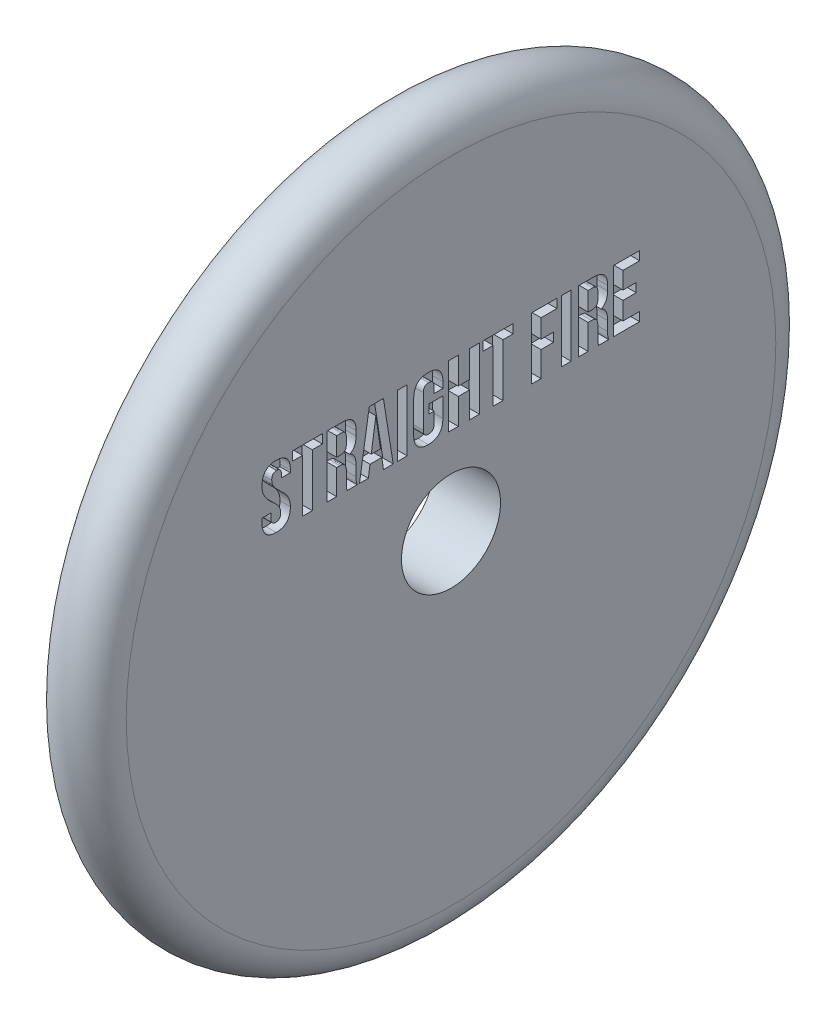
from build123d import *

# Parameters (mm, degrees)
SKETCH3_W          = 2.807368421
SKETCH3_H          = 17.78
CUT_EXTRUDE1_DEPTH = 3


with BuildPart() as part:
    # Sketch2 → Revolve1 (revolve)
    with BuildSketch(Plane(origin=(0, 0, 0), x_dir=(1, 0, 0), z_dir=(0, 1, 0))):
        with BuildLine():
            Line((9.525, -44.45), (-9.525, -44.45))
            Line((-9.525, -44.45), (-9.525, 34.925))
            ThreePointArc((-9.525, 34.925), (0, 44.45), (9.525, 34.925))
            Line((9.525, 34.925), (9.525, -44.45))
        make_face()
    revolve(axis=Axis((-9.525, 0, 58.7375), (1, 0, 0)))

    # Sketch3 → Cut-Extrude1 (cut)
    # profile 1 of 12: a face of its own
    with BuildSketch(Plane(origin=(9.525, 0, 0), x_dir=(0, 0, -1), z_dir=(1, 0, 0))):
        with BuildLine():
            add(Edge.make_bspline(
                [(-113.247236842, 38.45319886), (-113.245494337, 38.626413693), (-113.242111401, 38.96269661), (-113.185492696, 39.45037631), (-113.114942865, 39.909232136), (-112.997732304, 40.334633813), (-112.859492022, 40.732976119), (-112.675749379, 41.094373043), (-112.473905965, 41.432548931), (-112.22953693, 41.731612552), (-111.957579484, 42.003375303), (-111.649702948, 42.235020127), (-111.312883529, 42.437043426), (-110.942076352, 42.595666388), (-110.539299527, 42.721821432), (-110.105053755, 42.805503723), (-109.639664391, 42.863593822), (-109.319066149, 42.869535877), (-109.153157895, 42.872610866)],
                knots=[0, 0, 0, 0, 1.206355524, 2.342043972, 3.418431402, 4.438083895, 5.413196573, 6.351255772, 7.258638977, 8.152530083, 9.035258528, 9.932049271, 10.830647535, 11.766204879, 12.735829353, 13.766735853, 14.844295107, 16, 16, 16, 16], degree=3))
            add(Edge.make_bspline(
                [(-109.153157895, 42.872610866), (-108.987251489, 42.869476494), (-108.665446224, 42.863396815), (-108.200028118, 42.805926489), (-107.765144149, 42.722451723), (-107.364966679, 42.590986942), (-106.991700529, 42.43321278), (-106.655006317, 42.229254336), (-106.347326482, 41.994873641), (-106.076414964, 41.72067393), (-105.833182476, 41.416589707), (-105.625395024, 41.07816451), (-105.448132559, 40.709722738), (-105.3078109, 40.309262144), (-105.192993928, 39.879447986), (-105.114298869, 39.416973679), (-105.066091073, 38.923350868), (-105.06145751, 38.583691954), (-105.059078947, 38.409333728)],
                knots=[0, 0, 0, 0, 1.149502785, 2.229667057, 3.246762745, 4.213732507, 5.144269167, 6.049624213, 6.934898484, 7.818842031, 8.714531651, 9.628669906, 10.56558659, 11.543414927, 12.565757919, 13.64612032, 14.791675208, 16, 16, 16, 16], degree=3))
            Line((-105.059078947, 38.409333728), (-105.059078947, 37.725768761))
            Line((-105.059078947, 37.725768761), (-107.6325, 37.725768761))
            Line((-107.6325, 37.725768761), (-107.6325, 38.573827971))
            add(Edge.make_bspline(
                [(-107.6325, 38.573827971), (-107.635912199, 38.720293116), (-107.642270975, 38.993237098), (-107.707519769, 39.368758534), (-107.824760307, 39.675163611), (-107.987624707, 39.917805998), (-108.203302256, 40.086778084), (-108.44505496, 40.218029699), (-108.7307187, 40.283821097), (-108.931138019, 40.293904683), (-109.036184211, 40.299189814)],
                knots=[0, 0, 0, 0, 1.37650492, 2.565175047, 3.562948912, 4.443316981, 5.273581903, 6.113981485, 7.011477219, 8, 8, 8, 8], degree=3))
            add(Edge.make_bspline(
                [(-109.036184211, 40.299189814), (-109.141418299, 40.294477082), (-109.342499212, 40.285472012), (-109.625454926, 40.212196774), (-109.87145019, 40.088169529), (-110.083381658, 39.913533285), (-110.24789623, 39.671905988), (-110.364750876, 39.364968106), (-110.43012849, 38.989624534), (-110.436467064, 38.716652657), (-110.439868421, 38.570172544)],
                knots=[0, 0, 0, 0, 0.987915514, 1.887705382, 2.722343528, 3.559412626, 4.43923987, 5.436400785, 6.624340691, 8, 8, 8, 8], degree=3))
            add(Edge.make_bspline(
                [(-110.439868421, 38.570172544), (-110.434996383, 38.423619992), (-110.425513016, 38.138357132), (-110.350169168, 37.723000728), (-110.228061943, 37.332959901), (-109.985294695, 36.851020098), (-109.593873329, 36.290297098), (-109.03948345, 35.6572059), (-108.410662523, 35.050940783), (-107.742415557, 34.444787666), (-107.072724029, 33.810518216), (-106.554192903, 33.228761012), (-106.167325511, 32.731090971), (-105.905406664, 32.327780198), (-105.665732586, 31.901170193), (-105.4527228, 31.448291155), (-105.273811308, 30.961941826), (-105.145341283, 30.43520414), (-105.073962769, 29.866139001), (-105.06414037, 29.473228863), (-105.059078947, 29.270764649)],
                knots=[0, 0, 0, 0, 0.711271441, 1.384481704, 2.043180969, 2.688888555, 3.996911697, 5.351796161, 6.770259715, 8.235863846, 9.733980013, 11.246991605, 12.015089241, 12.793015811, 13.579825842, 14.389856151, 15.22096519, 16.092101288, 17.016871351, 18, 18, 18, 18], degree=3))
            add(Edge.make_bspline(
                [(-105.059078947, 29.270764649), (-105.06098451, 29.097580032), (-105.064684009, 28.761355775), (-105.118963495, 28.274251504), (-105.197064919, 27.81780903), (-105.310702561, 27.392031535), (-105.455401332, 26.995584912), (-105.637046565, 26.632082177), (-105.84378942, 26.29506896), (-106.091333299, 25.995735672), (-106.365538171, 25.726458369), (-106.67315045, 25.494085297), (-107.010360615, 25.296323362), (-107.379558937, 25.134436734), (-107.779536832, 25.010793952), (-108.210793887, 24.924801873), (-108.671582255, 24.868167906), (-108.98970578, 24.861889399), (-109.153157895, 24.858663498)],
                knots=[0, 0, 0, 0, 1.208931604, 2.347045229, 3.418793377, 4.440623261, 5.420741355, 6.360803708, 7.274613492, 8.175773814, 9.066465746, 9.953246112, 10.861092314, 11.790851666, 12.7625467, 13.778975678, 14.858835979, 16, 16, 16, 16], degree=3))
            add(Edge.make_bspline(
                [(-109.153157895, 24.858663498), (-109.316610271, 24.861889022), (-109.634734307, 24.868166794), (-110.095519077, 24.924805941), (-110.526788694, 25.01077993), (-110.926722837, 25.134485722), (-111.296075035, 25.296150743), (-111.633572802, 25.495202595), (-111.94389117, 25.725393871), (-112.219105991, 25.994503268), (-112.461351267, 26.297570536), (-112.674589059, 26.629744119), (-112.849649821, 26.99685682), (-112.996026943, 27.391812397), (-113.109132217, 27.817871879), (-113.187386739, 28.274233259), (-113.241622312, 28.76136079), (-113.245328061, 29.097581737), (-113.247236842, 29.270764649)],
                knots=[0, 0, 0, 0, 1.141004639, 2.220714119, 3.237001136, 4.208560456, 5.138189951, 6.045909358, 6.939358402, 7.829925934, 8.725600764, 9.643828138, 10.580015742, 11.559996947, 12.581684114, 13.653282575, 14.791237243, 16, 16, 16, 16], degree=3))
            Line((-113.247236842, 29.270764649), (-113.247236842, 30.47340034))
            Line((-113.247236842, 30.47340034), (-110.681126645, 30.47340034))
            Line((-110.681126645, 30.47340034), (-110.681126645, 29.113581261))
            add(Edge.make_bspline(
                [(-110.681126645, 29.113581261), (-110.676328291, 28.968308625), (-110.667472192, 28.700185647), (-110.602007477, 28.330501576), (-110.483080351, 28.028983109), (-110.310419692, 27.795514405), (-110.091722933, 27.632290882), (-109.847546571, 27.513613486), (-109.570161881, 27.442261955), (-109.375351708, 27.435572245), (-109.273787007, 27.43208455)],
                knots=[0, 0, 0, 0, 1.386265988, 2.558566959, 3.564945677, 4.453418966, 5.290801522, 6.143785094, 7.032258383, 8, 8, 8, 8], degree=3))
            add(Edge.make_bspline(
                [(-109.273787007, 27.43208455), (-109.170844447, 27.434999801), (-108.97419932, 27.440568634), (-108.697306563, 27.518735462), (-108.451080291, 27.634039056), (-108.238415859, 27.804682166), (-108.062120115, 28.037363308), (-107.94678107, 28.344666178), (-107.879596704, 28.719516992), (-107.871077698, 28.991395382), (-107.866447368, 29.139169254)],
                knots=[0, 0, 0, 0, 0.970990002, 1.85482519, 2.70053532, 3.52885375, 4.409750974, 5.428903785, 6.602533864, 8, 8, 8, 8], degree=3))
            add(Edge.make_bspline(
                [(-107.866447368, 29.139169254), (-107.871568779, 29.285654422), (-107.881579494, 29.571985947), (-107.953769226, 29.988675996), (-108.083913878, 30.376506717), (-108.262677001, 30.737047389), (-108.479271548, 31.077072472), (-108.71583194, 31.410119384), (-108.979426413, 31.732776439), (-109.372853956, 32.148263077), (-109.893188197, 32.668154982), (-110.564706746, 33.271060402), (-111.233504927, 33.907399905), (-111.75466891, 34.487539002), (-112.144535993, 34.984807404), (-112.398500139, 35.394282449), (-112.645427512, 35.817750784), (-112.85740066, 36.273232871), (-113.036628259, 36.760452122), (-113.159780618, 37.289335437), (-113.232691472, 37.857744158), (-113.242290514, 38.250707322), (-113.247236842, 38.45319886)],
                knots=[0, 0, 0, 0, 0.789355349, 1.542936557, 2.269747914, 2.986341759, 3.706087991, 4.440454517, 5.187108408, 5.949139981, 7.52326873, 9.149767973, 10.812348446, 12.495832652, 13.348252618, 14.213526384, 15.089941792, 15.988897831, 16.917420784, 17.882650749, 18.908942757, 20, 20, 20, 20], degree=3))
        make_face()
    # profile 2 of 12: a face of its own
    with BuildSketch(Plane(origin=(9.525, 0, 0), x_dir=(0, 0, -1), z_dir=(1, 0, 0))):
        Polygon((-104.455933388, 42.872610866), (-95.836435033, 42.872610866), (-95.836435033, 40.299189814), (-98.7425, 40.299189814), (-98.7425, 25.092610866), (-101.549868421, 25.092610866), (-101.549868421, 40.299189814), (-104.455933388, 40.299189814), align=None)
    # profile 3 of 12: a face of its own
    with BuildSketch(Plane(origin=(9.525, 0, 0), x_dir=(0, 0, -1), z_dir=(1, 0, 0))):
        with BuildLine():
            add(Edge.make_bspline(
                [(-88.660830592, 25.092610866), (-88.677351893, 25.150046255), (-88.709107875, 25.260444169), (-88.766329279, 25.42514524), (-88.81544991, 25.605338474), (-88.86189015, 25.82059515), (-88.886123707, 26.087763254), (-88.911191706, 26.416629194), (-88.91295174, 26.82167205), (-88.9153781, 27.118958346), (-88.916710526, 27.282212017)],
                knots=[0, 0, 0, 0, 0.646416717, 1.242492799, 1.88527074, 2.665971912, 3.620858849, 4.783497717, 6.233669654, 8, 8, 8, 8], degree=3))
            Line((-88.916710526, 27.282212017), (-88.916710526, 30.078614156))
            add(Edge.make_bspline(
                [(-88.916710526, 30.078614156), (-88.918481331, 30.178537684), (-88.921896429, 30.371245877), (-88.937593451, 30.6499577), (-88.975236942, 30.904841103), (-89.022857501, 31.136668724), (-89.078717324, 31.347577679), (-89.156308487, 31.53284331), (-89.243755369, 31.697286107), (-89.38065539, 31.882750242), (-89.596812287, 32.078053648), (-89.927080682, 32.233669225), (-90.319964607, 32.329089465), (-90.603677381, 32.339442878), (-90.755390625, 32.344979287)],
                knots=[0, 0, 0, 0, 1.063180337, 2.050403593, 2.966938367, 3.800733177, 4.568108724, 5.283005847, 5.93264735, 6.544464347, 7.72853363, 8.986425435, 10.388513958, 12, 12, 12, 12], degree=3))
            Line((-90.755390625, 32.344979287), (-91.724078947, 32.344979287))
            Line((-91.724078947, 32.344979287), (-91.724078947, 25.092610866))
            Line((-91.724078947, 25.092610866), (-94.531447368, 25.092610866))
            Line((-94.531447368, 25.092610866), (-94.531447368, 42.872610866))
            Line((-94.531447368, 42.872610866), (-90.280185033, 42.872610866))
            add(Edge.make_bspline(
                [(-90.280185033, 42.872610866), (-90.103398956, 42.870252913), (-89.761320451, 42.865690307), (-89.266303177, 42.818024941), (-88.809347919, 42.738032832), (-88.389736347, 42.630590132), (-88.008738498, 42.486600727), (-87.664943083, 42.312121939), (-87.357003955, 42.107111042), (-87.090405619, 41.865319321), (-86.859728953, 41.591936679), (-86.655520622, 41.288897376), (-86.485142348, 40.952130103), (-86.345196716, 40.583404656), (-86.240739806, 40.182278467), (-86.165081717, 39.749519619), (-86.116016607, 39.284103373), (-86.111613659, 38.962651468), (-86.109342105, 38.796809057)],
                knots=[0, 0, 0, 0, 1.260755043, 2.439542802, 3.54268581, 4.567257681, 5.524513305, 6.441873985, 7.312115338, 8.155196257, 8.999888502, 9.858066866, 10.755993349, 11.685786731, 12.666123341, 13.707841755, 14.817437245, 16, 16, 16, 16], degree=3))
            Line((-86.109342105, 38.796809057), (-86.109342105, 37.404091129))
            add(Edge.make_bspline(
                [(-86.109342105, 37.404091129), (-86.114476512, 37.185674674), (-86.12433208, 36.766421118), (-86.212135738, 36.166393847), (-86.357658108, 35.624892403), (-86.557370129, 35.138431007), (-86.822102344, 34.712103769), (-87.150769718, 34.350426964), (-87.530652331, 34.037121489), (-87.824087322, 33.887199889), (-87.973610197, 33.810805767)],
                knots=[0, 0, 0, 0, 1.219454911, 2.340761394, 3.377591561, 4.344542733, 5.267952596, 6.16435728, 7.064629016, 8, 8, 8, 8], degree=3))
            add(Edge.make_bspline(
                [(-87.973610197, 33.810805767), (-87.887525044, 33.77342605), (-87.717786806, 33.699722664), (-87.481298323, 33.563432383), (-87.263043849, 33.413913657), (-87.068253519, 33.244567235), (-86.894807593, 33.057359774), (-86.746010627, 32.850631173), (-86.611657471, 32.630919896), (-86.466620516, 32.307353571), (-86.318397133, 31.867298382), (-86.196411835, 31.294517184), (-86.123626409, 30.670233237), (-86.114217939, 30.237220467), (-86.109342105, 30.012816458)],
                knots=[0, 0, 0, 0, 0.746038726, 1.471000451, 2.167407001, 2.847638854, 3.519882004, 4.192614133, 4.870840316, 5.564746539, 7.008468503, 8.556058101, 10.215215764, 12, 12, 12, 12], degree=3))
            Line((-86.109342105, 30.012816458), (-86.109342105, 27.260279452))
            add(Edge.make_bspline(
                [(-86.109342105, 27.260279452), (-86.105903208, 27.053090812), (-86.099464451, 26.665164931), (-86.068528287, 26.108495006), (-85.984259705, 25.585597568), (-85.866220587, 25.259260994), (-85.805941612, 25.092610866)],
                knots=[0, 0, 0, 0, 1.128713682, 2.113326532, 3.036533446, 4, 4, 4, 4], degree=3))
            Line((-85.805941612, 25.092610866), (-88.660830592, 25.092610866))
        make_face()
        with BuildLine():
            Line((-91.724078947, 40.299189814), (-91.724078947, 34.91840034))
            Line((-91.724078947, 34.91840034), (-90.616484375, 34.91840034))
            add(Edge.make_bspline(
                [(-90.616484375, 34.91840034), (-90.490594637, 34.923061856), (-90.251089461, 34.931930389), (-89.911643787, 35.005310046), (-89.614410466, 35.128680917), (-89.35800646, 35.308734087), (-89.150792168, 35.562252992), (-89.012549705, 35.897938275), (-88.930538045, 36.309625451), (-88.921573499, 36.609195304), (-88.916710526, 36.771702149)],
                knots=[0, 0, 0, 0, 1.040413653, 1.979386563, 2.855406841, 3.686020353, 4.545419899, 5.524684786, 6.657222482, 8, 8, 8, 8], degree=3))
            Line((-88.916710526, 36.771702149), (-88.916710526, 38.497063991))
            add(Edge.make_bspline(
                [(-88.916710526, 38.497063991), (-88.920089859, 38.644840851), (-88.926385826, 38.920160955), (-88.992416829, 39.300064321), (-89.093090628, 39.619857182), (-89.250866334, 39.874598628), (-89.457169241, 40.070388463), (-89.714249032, 40.207405052), (-90.021983382, 40.287906269), (-90.24311061, 40.295274679), (-90.360604441, 40.299189814)],
                knots=[0, 0, 0, 0, 1.332324762, 2.48222755, 3.469917333, 4.339549643, 5.15640083, 6.007761516, 6.941443205, 8, 8, 8, 8], degree=3))
            Line((-90.360604441, 40.299189814), (-91.724078947, 40.299189814))
        make_face(mode=Mode.SUBTRACT)
    # profile 4 of 12: a face of its own
    with BuildSketch(Plane(origin=(9.525, 0, 0), x_dir=(0, 0, -1), z_dir=(1, 0, 0))):
        Polygon((-75.402594572, 25.092610866), (-78.206307566, 25.092610866), (-78.685168586, 28.367874024), (-82.099337993, 28.367874024), (-82.578199013, 25.092610866), (-85.1296875, 25.092610866), (-82.300386513, 42.872610866), (-78.231895559, 42.872610866), align=None)
        Polygon((-81.744761513, 30.707347708), (-79.065333059, 30.707347708), (-80.403219572, 39.652179123), align=None, mode=Mode.SUBTRACT)
    # profile 5 of 12: a face of its own
    with BuildSketch(Plane(origin=(9.525, 0, 0), x_dir=(0, 0, -1), z_dir=(1, 0, 0))):
        with Locations((-72.774342106, 33.982610866)):
            Rectangle(SKETCH3_W, SKETCH3_H)
    # profile 6 of 12: a face of its own
    with BuildSketch(Plane(origin=(9.525, 0, 0), x_dir=(0, 0, -1), z_dir=(1, 0, 0))):
        with BuildLine():
            Line((-65.054078947, 34.936677478), (-61.076973684, 34.936677478))
            Line((-61.076973684, 34.936677478), (-61.076973684, 29.325596064))
            add(Edge.make_bspline(
                [(-61.076973684, 29.325596064), (-61.080960991, 29.151262929), (-61.088699904, 28.812901942), (-61.134769424, 28.319993994), (-61.218766733, 27.859126159), (-61.335467173, 27.428273881), (-61.485817037, 27.028005304), (-61.66712624, 26.655823315), (-61.888652145, 26.319431156), (-62.137888266, 26.01233211), (-62.421965101, 25.74056501), (-62.735886169, 25.50139596), (-63.08518899, 25.303836553), (-63.462478255, 25.136892142), (-63.876061541, 25.015380999), (-64.318467828, 24.923878074), (-64.793144654, 24.868348653), (-65.119725771, 24.861957248), (-65.288026316, 24.858663498)],
                knots=[0, 0, 0, 0, 1.194042732, 2.317502508, 3.386327591, 4.398534127, 5.370341948, 6.310795775, 7.227362706, 8.122753804, 9.013935309, 9.913516301, 10.818153436, 11.756123454, 12.732863071, 13.763916448, 14.847655113, 16, 16, 16, 16], degree=3))
            add(Edge.make_bspline(
                [(-65.288026316, 24.858663498), (-65.456355791, 24.861823185), (-65.782993047, 24.867954443), (-66.257033998, 24.925287393), (-66.700595645, 25.010283244), (-67.112609349, 25.13444085), (-67.492520769, 25.296453798), (-67.842042951, 25.493526244), (-68.157595385, 25.729445369), (-68.442728771, 25.997948265), (-68.690438678, 26.303280783), (-68.907371754, 26.637823773), (-69.09134703, 27.002955131), (-69.241068903, 27.400116349), (-69.356759814, 27.828759201), (-69.441386701, 28.287051632), (-69.487332739, 28.776346273), (-69.495084318, 29.11227294), (-69.499078947, 29.28538636)],
                knots=[0, 0, 0, 0, 1.15723574, 2.245574074, 3.279340441, 4.260225597, 5.198852961, 6.114605703, 7.012976626, 7.9021542, 8.801345571, 9.71020866, 10.63966306, 11.607756255, 12.62425886, 13.689377335, 14.809264553, 16, 16, 16, 16], degree=3))
            Line((-69.499078947, 29.28538636), (-69.499078947, 38.445888004))
            add(Edge.make_bspline(
                [(-69.499078947, 38.445888004), (-69.495040619, 38.618998857), (-69.487175954, 38.956133144), (-69.441592517, 39.446666692), (-69.357301451, 39.905098509), (-69.240521087, 40.332252379), (-69.090495311, 40.729107232), (-68.908240331, 41.096270232), (-68.691522946, 41.431366847), (-68.441453556, 41.733478573), (-68.157754626, 42.001962509), (-67.841999215, 42.237711449), (-67.492532893, 42.43483073), (-67.112605908, 42.59683063), (-66.700596638, 42.720991952), (-66.257033712, 42.805986731), (-65.782993125, 42.863319987), (-65.456355818, 42.869451202), (-65.288026316, 42.872610866)],
                knots=[0, 0, 0, 0, 1.190640111, 2.318777811, 3.383811006, 4.392151913, 5.360167597, 6.297034964, 7.205825284, 8.098478489, 8.987584871, 9.885883865, 10.801563287, 11.7401155, 12.72092212, 13.754605719, 14.842856915, 16, 16, 16, 16], degree=3))
            add(Edge.make_bspline(
                [(-65.288026316, 42.872610866), (-65.119767833, 42.868887101), (-64.793404437, 42.861664281), (-64.318287478, 42.812043462), (-63.875779762, 42.719959555), (-63.464480766, 42.595919238), (-63.083104943, 42.440539222), (-62.738514457, 42.239462139), (-62.420757989, 42.009799382), (-62.138119536, 41.740728745), (-61.889631296, 41.438154644), (-61.668140276, 41.109322802), (-61.484966614, 40.746522751), (-61.334853156, 40.353204754), (-61.219815063, 39.929248861), (-61.134248062, 39.476007514), (-61.088795296, 38.9914739), (-61.080994492, 38.657988032), (-61.076973684, 38.486097708)],
                knots=[0, 0, 0, 0, 1.163067864, 2.255950316, 3.296598009, 4.282426534, 5.222507501, 6.135562604, 7.033458149, 7.927116913, 8.824340661, 9.735373492, 10.66200178, 11.627104322, 12.640608114, 13.694531985, 14.811680848, 16, 16, 16, 16], degree=3))
            Line((-61.076973684, 38.486097708), (-61.076973684, 36.789979287))
            Line((-61.076973684, 36.789979287), (-63.650394737, 36.789979287))
            Line((-63.650394737, 36.789979287), (-63.650394737, 38.617693103))
            add(Edge.make_bspline(
                [(-63.650394737, 38.617693103), (-63.654732835, 38.760579378), (-63.662816607, 39.026838942), (-63.735129079, 39.39420774), (-63.867663574, 39.693863996), (-64.053482846, 39.926118903), (-64.282683604, 40.097700218), (-64.549748231, 40.213833114), (-64.848816984, 40.290077181), (-65.060885685, 40.296074358), (-65.171052632, 40.299189814)],
                knots=[0, 0, 0, 0, 1.318101835, 2.456199662, 3.432506804, 4.312407925, 5.171583763, 6.047379065, 6.985638684, 8, 8, 8, 8], degree=3))
            add(Edge.make_bspline(
                [(-65.171052632, 40.299189814), (-65.2809804, 40.293860214), (-65.492222539, 40.283618616), (-65.795059603, 40.217196296), (-66.057236801, 40.088264238), (-66.291437741, 39.919148704), (-66.474000676, 39.678083326), (-66.607641965, 39.371129837), (-66.679035608, 38.993732174), (-66.687288562, 38.720322109), (-66.691710526, 38.573827971)],
                knots=[0, 0, 0, 0, 1.001091666, 1.923742725, 2.796739089, 3.643998758, 4.529096847, 5.512089028, 6.666967977, 8, 8, 8, 8], degree=3))
            Line((-66.691710526, 38.573827971), (-66.691710526, 29.131858399))
            add(Edge.make_bspline(
                [(-66.691710526, 29.131858399), (-66.687471531, 28.98529302), (-66.679594593, 28.712944011), (-66.606512324, 28.33755549), (-66.476325417, 28.031748321), (-66.289481463, 27.79787233), (-66.059066516, 27.629624099), (-65.791520426, 27.518259154), (-65.493388259, 27.440931753), (-65.28125376, 27.43510926), (-65.171052632, 27.43208455)],
                knots=[0, 0, 0, 0, 1.340899589, 2.491670802, 3.480464611, 4.353283275, 5.198873926, 6.063096006, 6.993803431, 8, 8, 8, 8], degree=3))
            add(Edge.make_bspline(
                [(-65.171052632, 27.43208455), (-65.060905436, 27.435225597), (-64.848874755, 27.441272037), (-64.549543034, 27.517175375), (-64.284061625, 27.634197209), (-64.051237821, 27.801391446), (-63.865967763, 28.039648888), (-63.736187532, 28.347464914), (-63.661922571, 28.72630074), (-63.65444786, 29.001117572), (-63.650394737, 29.150135537)],
                knots=[0, 0, 0, 0, 1.000478149, 1.925896174, 2.789704808, 3.630489795, 4.507022972, 5.500343297, 6.644574443, 8, 8, 8, 8], degree=3))
            Line((-63.650394737, 29.150135537), (-63.650394737, 32.407121557))
            Line((-63.650394737, 32.407121557), (-65.054078947, 32.407121557))
            Line((-65.054078947, 32.407121557), (-65.054078947, 34.936677478))
        make_face()
    # profile 7 of 12: a face of its own
    with BuildSketch(Plane(origin=(9.525, 0, 0), x_dir=(0, 0, -1), z_dir=(1, 0, 0))):
        Polygon((-56.631973684, 25.092610866), (-59.439342105, 25.092610866), (-59.439342105, 42.872610866), (-56.631973684, 42.872610866), (-56.631973684, 35.152347708), (-53.356710526, 35.152347708), (-53.356710526, 42.872610866), (-50.549342105, 42.872610866), (-50.549342105, 25.092610866), (-53.356710526, 25.092610866), (-53.356710526, 32.578926656), (-56.631973684, 32.578926656), align=None)
    # profile 8 of 12: a face of its own
    with BuildSketch(Plane(origin=(9.525, 0, 0), x_dir=(0, 0, -1), z_dir=(1, 0, 0))):
        Polygon((-49.478301809, 42.872610866), (-40.858803454, 42.872610866), (-40.858803454, 40.299189814), (-43.764868421, 40.299189814), (-43.764868421, 25.092610866), (-46.572236842, 25.092610866), (-46.572236842, 40.299189814), (-49.478301809, 40.299189814), align=None)
    # profile 9 of 12: a face of its own
    with BuildSketch(Plane(origin=(9.525, 0, 0), x_dir=(0, 0, -1), z_dir=(1, 0, 0))):
        Polygon((-32.769342105, 34.91840034), (-29.183367599, 34.91840034), (-29.183367599, 32.344979287), (-32.769342105, 32.344979287), (-32.769342105, 25.092610866), (-35.576710526, 25.092610866), (-35.576710526, 42.872610866), (-28.196402138, 42.872610866), (-28.196402138, 40.299189814), (-32.769342105, 40.299189814), align=None)
    # profile 10 of 12: a face of its own
    with BuildSketch(Plane(origin=(9.525, 0, 0), x_dir=(0, 0, -1), z_dir=(1, 0, 0))):
        with Locations((-25.516973685, 33.982610866)):
            Rectangle(SKETCH3_W, SKETCH3_H)
    # profile 11 of 12: a face of its own
    with BuildSketch(Plane(origin=(9.525, 0, 0), x_dir=(0, 0, -1), z_dir=(1, 0, 0))):
        with BuildLine():
            add(Edge.make_bspline(
                [(-16.137146382, 25.092610866), (-16.153667682, 25.150046255), (-16.185423664, 25.260444169), (-16.242645068, 25.42514524), (-16.2917657, 25.605338474), (-16.33820594, 25.82059515), (-16.362439496, 26.087763254), (-16.387507496, 26.416629194), (-16.389267529, 26.82167205), (-16.391693889, 27.118958346), (-16.393026316, 27.282212017)],
                knots=[0, 0, 0, 0, 0.646416717, 1.242492799, 1.88527074, 2.665971912, 3.620858849, 4.783497717, 6.233669654, 8, 8, 8, 8], degree=3))
            Line((-16.393026316, 27.282212017), (-16.393026316, 30.078614156))
            add(Edge.make_bspline(
                [(-16.393026316, 30.078614156), (-16.394797121, 30.178537684), (-16.398212218, 30.371245877), (-16.413909241, 30.6499577), (-16.451552732, 30.904841103), (-16.499173291, 31.136668724), (-16.555033113, 31.347577679), (-16.632624277, 31.53284331), (-16.720071158, 31.697286107), (-16.85697118, 31.882750242), (-17.073128076, 32.078053648), (-17.403396471, 32.233669225), (-17.796280397, 32.329089465), (-18.07999317, 32.339442878), (-18.231706414, 32.344979287)],
                knots=[0, 0, 0, 0, 1.063180337, 2.050403593, 2.966938367, 3.800733177, 4.568108724, 5.283005847, 5.93264735, 6.544464347, 7.72853363, 8.986425435, 10.388513958, 12, 12, 12, 12], degree=3))
            Line((-18.231706414, 32.344979287), (-19.200394737, 32.344979287))
            Line((-19.200394737, 32.344979287), (-19.200394737, 25.092610866))
            Line((-19.200394737, 25.092610866), (-22.007763158, 25.092610866))
            Line((-22.007763158, 25.092610866), (-22.007763158, 42.872610866))
            Line((-22.007763158, 42.872610866), (-17.756500822, 42.872610866))
            add(Edge.make_bspline(
                [(-17.756500822, 42.872610866), (-17.579714746, 42.870252913), (-17.237636241, 42.865690307), (-16.742618966, 42.818024941), (-16.285663709, 42.738032832), (-15.866052136, 42.630590132), (-15.485054287, 42.486600727), (-15.141258872, 42.312121939), (-14.833319744, 42.107111042), (-14.566721408, 41.865319321), (-14.336044742, 41.591936679), (-14.131836411, 41.288897376), (-13.961458138, 40.952130103), (-13.821512506, 40.583404656), (-13.717055595, 40.182278467), (-13.641397506, 39.749519619), (-13.592332396, 39.284103373), (-13.587929449, 38.962651468), (-13.585657895, 38.796809057)],
                knots=[0, 0, 0, 0, 1.260755043, 2.439542802, 3.54268581, 4.567257681, 5.524513305, 6.441873985, 7.312115338, 8.155196257, 8.999888502, 9.858066866, 10.755993349, 11.685786731, 12.666123341, 13.707841755, 14.817437245, 16, 16, 16, 16], degree=3))
            Line((-13.585657895, 38.796809057), (-13.585657895, 37.404091129))
            add(Edge.make_bspline(
                [(-13.585657895, 37.404091129), (-13.590792301, 37.185674674), (-13.600647869, 36.766421118), (-13.688451528, 36.166393847), (-13.833973897, 35.624892403), (-14.033685918, 35.138431007), (-14.298418133, 34.712103769), (-14.627085507, 34.350426964), (-15.00696812, 34.037121489), (-15.300403112, 33.887199889), (-15.449925987, 33.810805767)],
                knots=[0, 0, 0, 0, 1.219454911, 2.340761394, 3.377591561, 4.344542733, 5.267952596, 6.16435728, 7.064629016, 8, 8, 8, 8], degree=3))
            add(Edge.make_bspline(
                [(-15.449925987, 33.810805767), (-15.363840834, 33.77342605), (-15.194102596, 33.699722664), (-14.957614113, 33.563432383), (-14.739359639, 33.413913657), (-14.544569309, 33.244567235), (-14.371123382, 33.057359774), (-14.222326417, 32.850631173), (-14.087973261, 32.630919896), (-13.942936306, 32.307353571), (-13.794712922, 31.867298382), (-13.672727625, 31.294517184), (-13.599942198, 30.670233237), (-13.590533729, 30.237220467), (-13.585657895, 30.012816458)],
                knots=[0, 0, 0, 0, 0.746038726, 1.471000451, 2.167407001, 2.847638854, 3.519882004, 4.192614133, 4.870840316, 5.564746539, 7.008468503, 8.556058101, 10.215215764, 12, 12, 12, 12], degree=3))
            Line((-13.585657895, 30.012816458), (-13.585657895, 27.260279452))
            add(Edge.make_bspline(
                [(-13.585657895, 27.260279452), (-13.582218997, 27.053090812), (-13.575780241, 26.665164931), (-13.544844076, 26.108495006), (-13.460575495, 25.585597568), (-13.342536376, 25.259260994), (-13.282257401, 25.092610866)],
                knots=[0, 0, 0, 0, 1.128713682, 2.113326532, 3.036533446, 4, 4, 4, 4], degree=3))
            Line((-13.282257401, 25.092610866), (-16.137146382, 25.092610866))
        make_face()
        with BuildLine():
            Line((-19.200394737, 40.299189814), (-19.200394737, 34.91840034))
            Line((-19.200394737, 34.91840034), (-18.092800164, 34.91840034))
            add(Edge.make_bspline(
                [(-18.092800164, 34.91840034), (-17.966910427, 34.923061856), (-17.72740525, 34.931930389), (-17.387959577, 35.005310046), (-17.090726256, 35.128680917), (-16.834322249, 35.308734087), (-16.627107957, 35.562252992), (-16.488865494, 35.897938275), (-16.406853834, 36.309625451), (-16.397889289, 36.609195304), (-16.393026316, 36.771702149)],
                knots=[0, 0, 0, 0, 1.040413653, 1.979386563, 2.855406841, 3.686020353, 4.545419899, 5.524684786, 6.657222482, 8, 8, 8, 8], degree=3))
            Line((-16.393026316, 36.771702149), (-16.393026316, 38.497063991))
            add(Edge.make_bspline(
                [(-16.393026316, 38.497063991), (-16.396405649, 38.644840851), (-16.402701616, 38.920160955), (-16.468732618, 39.300064321), (-16.569406418, 39.619857182), (-16.727182123, 39.874598628), (-16.933485031, 40.070388463), (-17.190564822, 40.207405052), (-17.498299171, 40.287906269), (-17.7194264, 40.295274679), (-17.83692023, 40.299189814)],
                knots=[0, 0, 0, 0, 1.332324762, 2.48222755, 3.469917333, 4.339549643, 5.15640083, 6.007761516, 6.941443205, 8, 8, 8, 8], degree=3))
            Line((-17.83692023, 40.299189814), (-19.200394737, 40.299189814))
        make_face(mode=Mode.SUBTRACT)
    # profile 12 of 12: a face of its own
    with BuildSketch(Plane(origin=(9.525, 0, 0), x_dir=(0, 0, -1), z_dir=(1, 0, 0))):
        Polygon((-9.140657895, 35.386295077), (-5.324391447, 35.386295077), (-5.324391447, 32.812874024), (-9.140657895, 32.812874024), (-9.140657895, 27.666031919), (-4.341081414, 27.666031919), (-4.341081414, 25.092610866), (-11.948026316, 25.092610866), (-11.948026316, 42.872610866), (-4.341081414, 42.872610866), (-4.341081414, 40.299189814), (-9.140657895, 40.299189814), align=None)
    extrude(amount=-CUT_EXTRUDE1_DEPTH, mode=Mode.SUBTRACT)


solid = part.part
